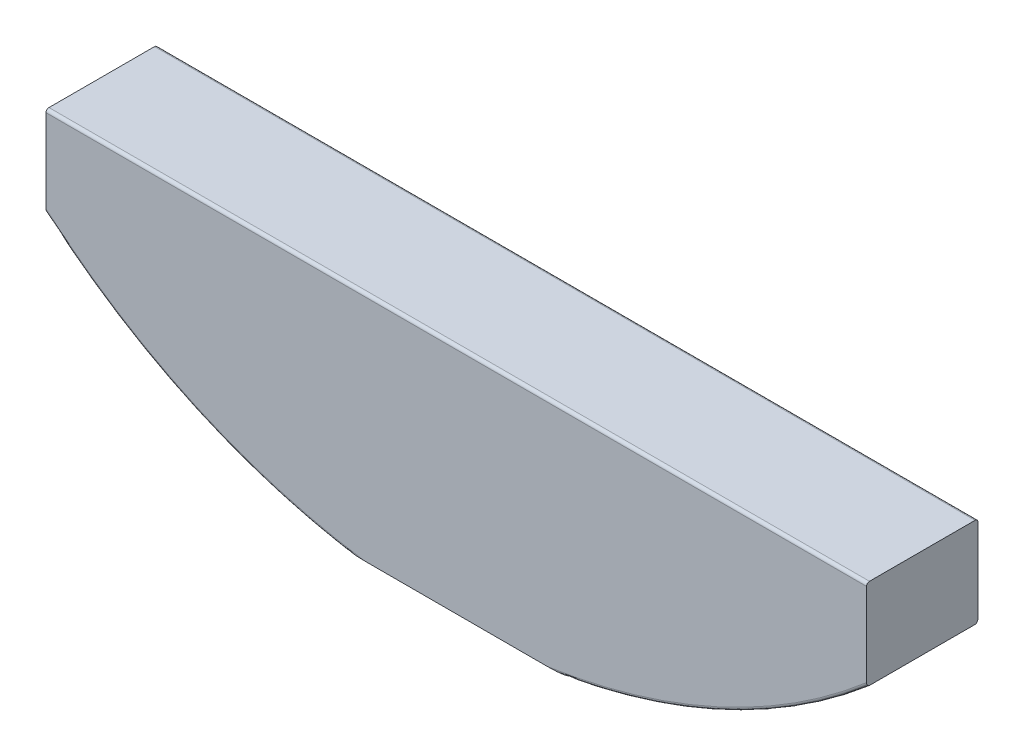
from build123d import *

# Parameters (mm, degrees)
EXTRUDE1_DEPTH          = 4.7625
FILLET3_R               = 0.127
CUT_EXTRUDE2_DEPTH      = 35.579418574
CUT_EXTRUDE2_DEPTH_BACK = 35.579418574
CUT_EXTRUDE1_DEPTH      = 35.258259896


with BuildPart() as part:
    # Sketch1 → Extrude1 (new body)
    with BuildSketch(Plane.XY):
        with BuildLine():
            Line((-21.224465357, -16.66875), (21.224465357, -16.66875))
            ThreePointArc((21.224465357, -16.66875), (0, -26.9875), (-21.224465357, -16.66875))
        make_face()
    extrude(amount=EXTRUDE1_DEPTH)

    # Fillet3
    fillet3_edges = [part.edges().sort_by_distance(p)[0] for p in [
        (21.224465357, -16.66875, 2.38125),
        (-21.224465357, -16.66875, 2.38125),
        (0, -16.66875, 4.7625),
        (0, -26.9875, 4.7625),
        (0, -16.66875, 0),
        (0, -26.9875, 0),
    ]]
    fillet(fillet3_edges, radius=FILLET3_R)

    # Sketch3 → Cut-Extrude2 (cut, two sides: drawn at the far end of the back side and taken through both)
    with BuildSketch(Plane.XY.offset(-CUT_EXTRUDE2_DEPTH_BACK)):
        Polygon((-205.935820426, -26.57475), (-50.8, -26.57475), (50.8, -26.57475), (205.935820426, -26.57475), (205.935820426, -336.846390851), (-205.935820426, -336.846390851), align=None)
    extrude(amount=CUT_EXTRUDE2_DEPTH + CUT_EXTRUDE2_DEPTH_BACK, mode=Mode.SUBTRACT)

    # Sketch2 → Cut-Extrude1 (cut, symmetric)
    with BuildSketch(Plane.XY):
        Polygon((-17.526, 113.073383672), (-17.526, 0), (-17.526, -50.8), (-17.526, -163.873383672), (-243.672767343, -163.873383672), (-243.672767343, 113.073383672), align=None)
    cut_extrude1 = extrude(amount=CUT_EXTRUDE1_DEPTH, both=True, mode=Mode.SUBTRACT)

    # Mirror1: Cut-Extrude1 across plane
    add(cut_extrude1.mirror(Plane(origin=(0, 0, 0), x_dir=(0, 0, 1), z_dir=(1, 0, 0))), mode=Mode.SUBTRACT)


solid = part.part
